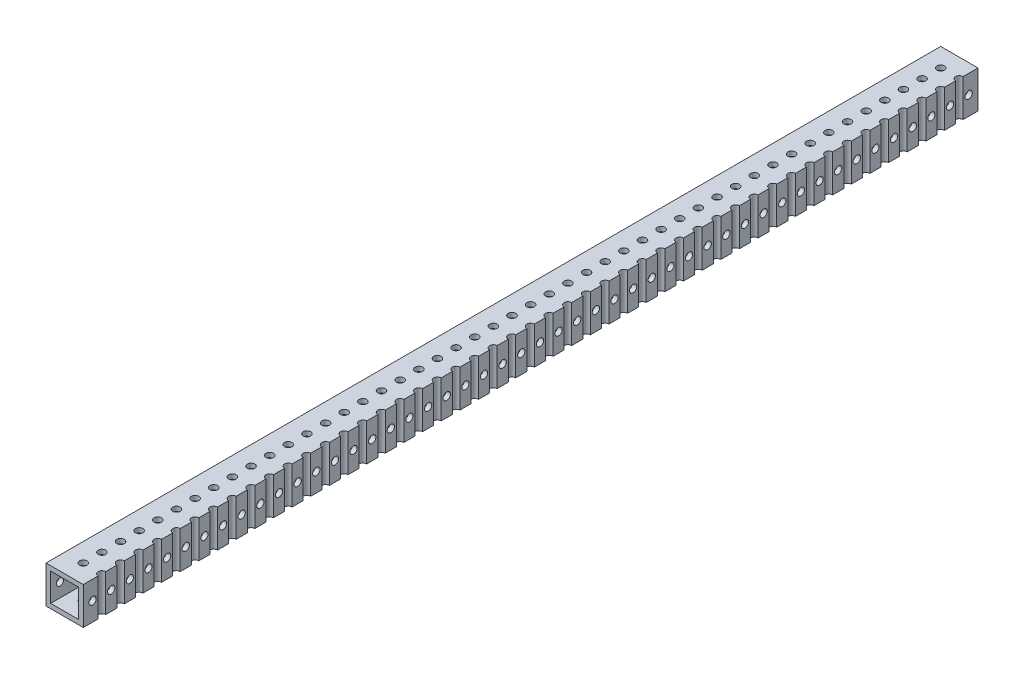
from build123d import *

# Parameters (mm, degrees)
SKETCH1_W           = 25.4
SKETCH1_H           = 25.4
SKETCH1_W_2         = 19.05
SKETCH1_H_2         = 19.05
BOSS_EXTRUDE1_DEPTH = 304.8
SKETCH2_R           = 2.5527
CUT_EXTRUDE1_DEPTH  = 307.120058147
SKETCH4_R           = 2.4892
CUT_EXTRUDE3_DEPTH  = 307.120058147


with BuildPart() as part:
    # Sketch1 → Boss-Extrude1 (new, symmetric)
    with BuildSketch(Plane.XY):
        Rectangle(SKETCH1_W, SKETCH1_H)
        Rectangle(SKETCH1_W_2, SKETCH1_H_2, mode=Mode.SUBTRACT)
    extrude(amount=BOSS_EXTRUDE1_DEPTH, both=True)

    # Sketch2 → Cut-Extrude1 (cut, through all)
    with BuildSketch(Plane(origin=(0, 12.7, 0), x_dir=(1, 0, 0), z_dir=(0, 1, 0))):
        with Locations((12.7, -292.1)):
            Circle(SKETCH2_R)
        with Locations((25.4, -292.1)):
            Circle(SKETCH2_R)
        with Locations((0, -292.1)):
            Circle(SKETCH2_R)
        with Locations((0, -279.4)):
            Circle(SKETCH2_R)
        with Locations((12.7, -279.4)):
            Circle(SKETCH2_R)
        with Locations((25.4, -279.4)):
            Circle(SKETCH2_R)
        with Locations((0, -266.7)):
            Circle(SKETCH2_R)
        with Locations((12.7, -266.7)):
            Circle(SKETCH2_R)
        with Locations((25.4, -266.7)):
            Circle(SKETCH2_R)
        with Locations((0, -254)):
            Circle(SKETCH2_R)
        with Locations((12.7, -254)):
            Circle(SKETCH2_R)
        with Locations((25.4, -254)):
            Circle(SKETCH2_R)
        with Locations((0, -241.3)):
            Circle(SKETCH2_R)
        with Locations((12.7, -241.3)):
            Circle(SKETCH2_R)
        with Locations((25.4, -241.3)):
            Circle(SKETCH2_R)
        with Locations((0, -228.6)):
            Circle(SKETCH2_R)
        with Locations((12.7, -228.6)):
            Circle(SKETCH2_R)
        with Locations((25.4, -228.6)):
            Circle(SKETCH2_R)
        with Locations((0, -215.9)):
            Circle(SKETCH2_R)
        with Locations((12.7, -215.9)):
            Circle(SKETCH2_R)
        with Locations((25.4, -215.9)):
            Circle(SKETCH2_R)
        with Locations((0, -203.2)):
            Circle(SKETCH2_R)
        with Locations((12.7, -203.2)):
            Circle(SKETCH2_R)
        with Locations((25.4, -203.2)):
            Circle(SKETCH2_R)
        with Locations((0, -190.5)):
            Circle(SKETCH2_R)
        with Locations((12.7, -190.5)):
            Circle(SKETCH2_R)
        with Locations((25.4, -190.5)):
            Circle(SKETCH2_R)
        with Locations((0, -177.8)):
            Circle(SKETCH2_R)
        with Locations((12.7, -177.8)):
            Circle(SKETCH2_R)
        with Locations((25.4, -177.8)):
            Circle(SKETCH2_R)
        with Locations((0, -165.1)):
            Circle(SKETCH2_R)
        with Locations((12.7, -165.1)):
            Circle(SKETCH2_R)
        with Locations((25.4, -165.1)):
            Circle(SKETCH2_R)
        with Locations((0, -152.4)):
            Circle(SKETCH2_R)
        with Locations((12.7, -152.4)):
            Circle(SKETCH2_R)
        with Locations((25.4, -152.4)):
            Circle(SKETCH2_R)
        with Locations((0, -139.7)):
            Circle(SKETCH2_R)
        with Locations((12.7, -139.7)):
            Circle(SKETCH2_R)
        with Locations((25.4, -139.7)):
            Circle(SKETCH2_R)
        with Locations((0, -127)):
            Circle(SKETCH2_R)
        with Locations((12.7, -127)):
            Circle(SKETCH2_R)
        with Locations((25.4, -127)):
            Circle(SKETCH2_R)
        with Locations((0, -114.3)):
            Circle(SKETCH2_R)
        with Locations((12.7, -114.3)):
            Circle(SKETCH2_R)
        with Locations((25.4, -114.3)):
            Circle(SKETCH2_R)
        with Locations((0, -101.6)):
            Circle(SKETCH2_R)
        with Locations((12.7, -101.6)):
            Circle(SKETCH2_R)
        with Locations((25.4, -101.6)):
            Circle(SKETCH2_R)
        with Locations((0, -88.9)):
            Circle(SKETCH2_R)
        with Locations((12.7, -88.9)):
            Circle(SKETCH2_R)
        with Locations((25.4, -88.9)):
            Circle(SKETCH2_R)
        with Locations((0, -76.2)):
            Circle(SKETCH2_R)
        with Locations((12.7, -76.2)):
            Circle(SKETCH2_R)
        with Locations((25.4, -76.2)):
            Circle(SKETCH2_R)
        with Locations((0, -63.5)):
            Circle(SKETCH2_R)
        with Locations((12.7, -63.5)):
            Circle(SKETCH2_R)
        with Locations((25.4, -63.5)):
            Circle(SKETCH2_R)
        with Locations((0, -50.8)):
            Circle(SKETCH2_R)
        with Locations((12.7, -50.8)):
            Circle(SKETCH2_R)
        with Locations((25.4, -50.8)):
            Circle(SKETCH2_R)
        with Locations((0, -38.1)):
            Circle(SKETCH2_R)
        with Locations((12.7, -38.1)):
            Circle(SKETCH2_R)
        with Locations((25.4, -38.1)):
            Circle(SKETCH2_R)
        with Locations((0, -25.4)):
            Circle(SKETCH2_R)
        with Locations((12.7, -25.4)):
            Circle(SKETCH2_R)
        with Locations((25.4, -25.4)):
            Circle(SKETCH2_R)
        with Locations((0, -12.7)):
            Circle(SKETCH2_R)
        with Locations((12.7, -12.7)):
            Circle(SKETCH2_R)
        with Locations((25.4, -12.7)):
            Circle(SKETCH2_R)
        Circle(SKETCH2_R)
        with Locations((12.7, 0)):
            Circle(SKETCH2_R)
        with Locations((25.4, 0)):
            Circle(SKETCH2_R)
        with Locations((0, 12.7)):
            Circle(SKETCH2_R)
        with Locations((12.7, 12.7)):
            Circle(SKETCH2_R)
        with Locations((25.4, 12.7)):
            Circle(SKETCH2_R)
        with Locations((0, 25.4)):
            Circle(SKETCH2_R)
        with Locations((12.7, 25.4)):
            Circle(SKETCH2_R)
        with Locations((25.4, 25.4)):
            Circle(SKETCH2_R)
        with Locations((0, 38.1)):
            Circle(SKETCH2_R)
        with Locations((12.7, 38.1)):
            Circle(SKETCH2_R)
        with Locations((25.4, 38.1)):
            Circle(SKETCH2_R)
        with Locations((0, 50.8)):
            Circle(SKETCH2_R)
        with Locations((12.7, 50.8)):
            Circle(SKETCH2_R)
        with Locations((25.4, 50.8)):
            Circle(SKETCH2_R)
        with Locations((0, 63.5)):
            Circle(SKETCH2_R)
        with Locations((12.7, 63.5)):
            Circle(SKETCH2_R)
        with Locations((25.4, 63.5)):
            Circle(SKETCH2_R)
        with Locations((0, 76.2)):
            Circle(SKETCH2_R)
        with Locations((12.7, 76.2)):
            Circle(SKETCH2_R)
        with Locations((25.4, 76.2)):
            Circle(SKETCH2_R)
        with Locations((0, 88.9)):
            Circle(SKETCH2_R)
        with Locations((12.7, 88.9)):
            Circle(SKETCH2_R)
        with Locations((25.4, 88.9)):
            Circle(SKETCH2_R)
        with Locations((0, 101.6)):
            Circle(SKETCH2_R)
        with Locations((12.7, 101.6)):
            Circle(SKETCH2_R)
        with Locations((25.4, 101.6)):
            Circle(SKETCH2_R)
        with Locations((0, 114.3)):
            Circle(SKETCH2_R)
        with Locations((12.7, 114.3)):
            Circle(SKETCH2_R)
        with Locations((25.4, 114.3)):
            Circle(SKETCH2_R)
        with Locations((0, 127)):
            Circle(SKETCH2_R)
        with Locations((12.7, 127)):
            Circle(SKETCH2_R)
        with Locations((25.4, 127)):
            Circle(SKETCH2_R)
        with Locations((25.4, 139.7)):
            Circle(SKETCH2_R)
        with Locations((12.7, 139.7)):
            Circle(SKETCH2_R)
        with Locations((0, 139.7)):
            Circle(SKETCH2_R)
        with Locations((25.4, 152.4)):
            Circle(SKETCH2_R)
        with Locations((12.7, 152.4)):
            Circle(SKETCH2_R)
        with Locations((0, 152.4)):
            Circle(SKETCH2_R)
        with Locations((25.4, 165.1)):
            Circle(SKETCH2_R)
        with Locations((12.7, 165.1)):
            Circle(SKETCH2_R)
        with Locations((0, 165.1)):
            Circle(SKETCH2_R)
        with Locations((25.4, 177.8)):
            Circle(SKETCH2_R)
        with Locations((12.7, 177.8)):
            Circle(SKETCH2_R)
        with Locations((0, 177.8)):
            Circle(SKETCH2_R)
        with Locations((25.4, 190.5)):
            Circle(SKETCH2_R)
        with Locations((12.7, 190.5)):
            Circle(SKETCH2_R)
        with Locations((0, 190.5)):
            Circle(SKETCH2_R)
        with Locations((25.4, 203.2)):
            Circle(SKETCH2_R)
        with Locations((12.7, 203.2)):
            Circle(SKETCH2_R)
        with Locations((0, 203.2)):
            Circle(SKETCH2_R)
        with Locations((25.4, 215.9)):
            Circle(SKETCH2_R)
        with Locations((12.7, 215.9)):
            Circle(SKETCH2_R)
        with Locations((0, 215.9)):
            Circle(SKETCH2_R)
        with Locations((25.4, 228.6)):
            Circle(SKETCH2_R)
        with Locations((12.7, 228.6)):
            Circle(SKETCH2_R)
        with Locations((0, 228.6)):
            Circle(SKETCH2_R)
        with Locations((25.4, 241.3)):
            Circle(SKETCH2_R)
        with Locations((12.7, 241.3)):
            Circle(SKETCH2_R)
        with Locations((0, 241.3)):
            Circle(SKETCH2_R)
        with Locations((25.4, 254)):
            Circle(SKETCH2_R)
        with Locations((12.7, 254)):
            Circle(SKETCH2_R)
        with Locations((0, 254)):
            Circle(SKETCH2_R)
        with Locations((25.4, 266.7)):
            Circle(SKETCH2_R)
        with Locations((12.7, 266.7)):
            Circle(SKETCH2_R)
        with Locations((0, 266.7)):
            Circle(SKETCH2_R)
        with Locations((25.4, 279.4)):
            Circle(SKETCH2_R)
        with Locations((12.7, 279.4)):
            Circle(SKETCH2_R)
        with Locations((0, 279.4)):
            Circle(SKETCH2_R)
        with Locations((25.4, 292.1)):
            Circle(SKETCH2_R)
        with Locations((12.7, 292.1)):
            Circle(SKETCH2_R)
        with Locations((0, 292.1)):
            Circle(SKETCH2_R)
    extrude(amount=-CUT_EXTRUDE1_DEPTH, mode=Mode.SUBTRACT)

    # Sketch4 → Cut-Extrude3 (cut, through all)
    with BuildSketch(Plane(origin=(12.7, 0, 0), x_dir=(0, 0, -1), z_dir=(1, 0, 0))):
        with Locations((-298.45, 0)):
            Circle(SKETCH4_R)
        with Locations((-285.75, 0)):
            Circle(SKETCH4_R)
        with Locations((-273.05, 0)):
            Circle(SKETCH4_R)
        with Locations((-260.35, 0)):
            Circle(SKETCH4_R)
        with Locations((-247.65, 0)):
            Circle(SKETCH4_R)
        with Locations((133.35, 0)):
            Circle(SKETCH4_R)
        with Locations((146.05, 0)):
            Circle(SKETCH4_R)
        with Locations((158.75, 0)):
            Circle(SKETCH4_R)
        with Locations((171.45, 0)):
            Circle(SKETCH4_R)
        with Locations((184.15, 0)):
            Circle(SKETCH4_R)
        with Locations((196.85, 0)):
            Circle(SKETCH4_R)
        with Locations((209.55, 0)):
            Circle(SKETCH4_R)
        with Locations((222.25, 0)):
            Circle(SKETCH4_R)
        with Locations((234.95, 0)):
            Circle(SKETCH4_R)
        with Locations((247.65, 0)):
            Circle(SKETCH4_R)
        with Locations((260.35, 0)):
            Circle(SKETCH4_R)
        with Locations((273.05, 0)):
            Circle(SKETCH4_R)
        with Locations((285.75, 0)):
            Circle(SKETCH4_R)
        with Locations((298.45, 0)):
            Circle(SKETCH4_R)
        with Locations((-234.95, 0)):
            Circle(SKETCH4_R)
        with Locations((-222.25, 0)):
            Circle(SKETCH4_R)
        with Locations((-209.55, 0)):
            Circle(SKETCH4_R)
        with Locations((-196.85, 0)):
            Circle(SKETCH4_R)
        with Locations((-184.15, 0)):
            Circle(SKETCH4_R)
        with Locations((-171.45, 0)):
            Circle(SKETCH4_R)
        with Locations((-158.75, 0)):
            Circle(SKETCH4_R)
        with Locations((-146.05, 0)):
            Circle(SKETCH4_R)
        with Locations((-133.35, 0)):
            Circle(SKETCH4_R)
        with Locations((-120.65, 0)):
            Circle(SKETCH4_R)
        with Locations((-107.95, 0)):
            Circle(SKETCH4_R)
        with Locations((-95.25, 0)):
            Circle(SKETCH4_R)
        with Locations((-82.55, 0)):
            Circle(SKETCH4_R)
        with Locations((-69.85, 0)):
            Circle(SKETCH4_R)
        with Locations((-57.15, 0)):
            Circle(SKETCH4_R)
        with Locations((-44.45, 0)):
            Circle(SKETCH4_R)
        with Locations((-31.75, 0)):
            Circle(SKETCH4_R)
        with Locations((-19.05, 0)):
            Circle(SKETCH4_R)
        with Locations((-6.35, 0)):
            Circle(SKETCH4_R)
        with Locations((6.35, 0)):
            Circle(SKETCH4_R)
        with Locations((19.05, 0)):
            Circle(SKETCH4_R)
        with Locations((31.75, 0)):
            Circle(SKETCH4_R)
        with Locations((44.45, 0)):
            Circle(SKETCH4_R)
        with Locations((57.15, 0)):
            Circle(SKETCH4_R)
        with Locations((69.85, 0)):
            Circle(SKETCH4_R)
        with Locations((82.55, 0)):
            Circle(SKETCH4_R)
        with Locations((95.25, 0)):
            Circle(SKETCH4_R)
        with Locations((107.95, 0)):
            Circle(SKETCH4_R)
        with Locations((120.65, 0)):
            Circle(SKETCH4_R)
    extrude(amount=-CUT_EXTRUDE3_DEPTH, mode=Mode.SUBTRACT)


solid = part.part
